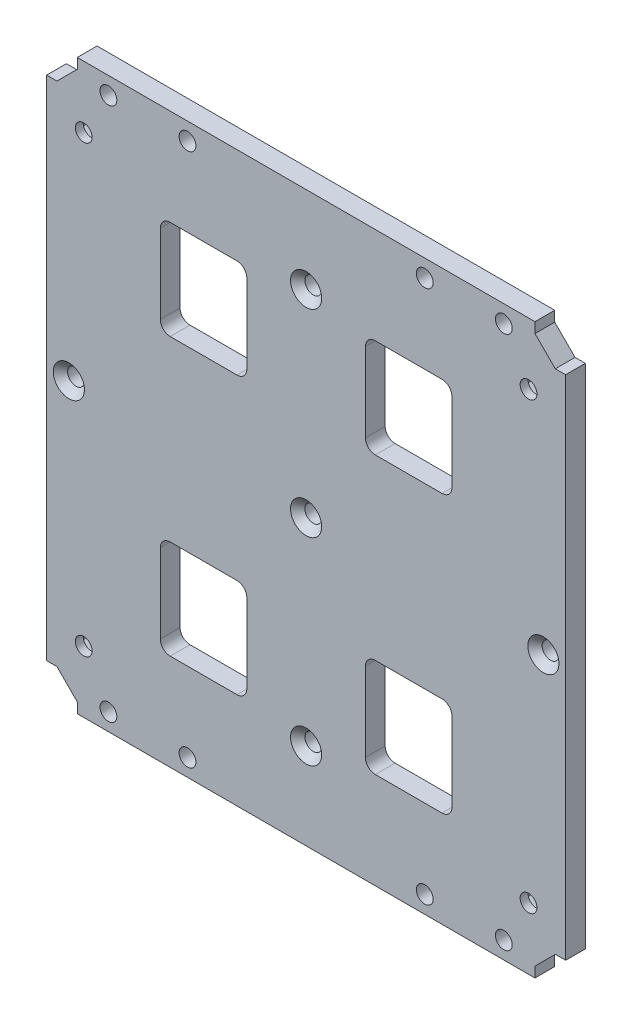
from build123d import *

# Parameters (mm, degrees)
BOSS_EXTRUDE1_DEPTH                             = 4
CUT_EXTRUDE4_DEPTH                              = 2.4
M3_CLEARANCE_HOLE1_D                            = 3.4
CSK_FOR_M3_FLAT_HEAD_MACHINE_SCREW1_D           = 3.4
CSK_FOR_M3_FLAT_HEAD_MACHINE_SCREW1_CSINK_D     = 6.3
CSK_FOR_M3_FLAT_HEAD_MACHINE_SCREW1_CSINK_ANGLE = 90
SKETCH11_W                                      = 17.5
SKETCH11_H                                      = 20
CUT_EXTRUDE3_DEPTH                              = 78.964735618
FILLET1_R                                       = 2
CSK_FOR_M3_FLAT_HEAD_MACHINE_SCREW2_D           = 3.4
CSK_FOR_M3_FLAT_HEAD_MACHINE_SCREW2_CSINK_D     = 6.3
CSK_FOR_M3_FLAT_HEAD_MACHINE_SCREW2_CSINK_ANGLE = 90
MOVE_FACE1_DEPTH                                = 4


# Read off the part's stored shape, not the designer's step: Move Face1
with BuildPart() as part:
    # Sketch2 → Boss-Extrude1 (new body)
    with BuildSketch(Plane.XY):
        Polygon((0, 57.5), (0, 0), (52.5, 0), (52.5, 51.5), (50.5, 51.5), (46.5, 55.5), (46.5, 57.5), align=None)
    extrude(amount=BOSS_EXTRUDE1_DEPTH)

    # Sketch12 → Cut-Extrude4 (cut)
    with BuildSketch(Plane.XY):
        Polygon((45, 41.766838493), (47.8, 43.383419246), (47.8, 46.616580754), (45, 48.233161507), (42.2, 46.616580754), (42.2, 43.383419246), align=None)
    extrude(amount=CUT_EXTRUDE4_DEPTH, mode=Mode.SUBTRACT)

    # M3 Clearance Hole1 (through all)
    with Locations(Plane.XY.offset(4)):
        with Locations((45, 45), (-45, 45), (-45, -45), (45, -45)):
            Hole(M3_CLEARANCE_HOLE1_D / 2)

    # CSK for M3 Flat Head Machine Screw1 (through all)
    with Locations(Plane.XY.offset(4)):
        with Locations((0, 40), (0, 0), (48, 0)):
            CounterSinkHole(CSK_FOR_M3_FLAT_HEAD_MACHINE_SCREW1_D / 2, CSK_FOR_M3_FLAT_HEAD_MACHINE_SCREW1_CSINK_D / 2, counter_sink_angle=CSK_FOR_M3_FLAT_HEAD_MACHINE_SCREW1_CSINK_ANGLE)

    # Sketch11 → Cut-Extrude3 (cut, through all)
    with BuildSketch(Plane.XY):
        with Locations((20.75, 28)):
            Rectangle(SKETCH11_W, SKETCH11_H)
    extrude(amount=CUT_EXTRUDE3_DEPTH, mode=Mode.SUBTRACT)

    # Fillet1
    fillet1_edges = [part.edges().sort_by_distance(p)[0] for p in [
        (29.5, 38, 2),
        (12, 38, 2),
        (12, 18, 2),
        (29.5, 18, 2),
    ]]
    fillet(fillet1_edges, radius=FILLET1_R)

    # CSK for M3 Flat Head Machine Screw2 (through all)
    with Locations(Plane(origin=(0, 0, 0), x_dir=(-1, 0, 0), z_dir=(0, 0, -1))):
        with Locations((-24, 54), (-40, 54)):
            CounterSinkHole(CSK_FOR_M3_FLAT_HEAD_MACHINE_SCREW2_D / 2, CSK_FOR_M3_FLAT_HEAD_MACHINE_SCREW2_CSINK_D / 2, counter_sink_angle=CSK_FOR_M3_FLAT_HEAD_MACHINE_SCREW2_CSINK_ANGLE)

    # Move Face1 outline → Move Face1 (cut)
    with BuildSketch(Plane.XY):
        Polygon((46.3, 55.417157288), (50.417157288, 51.3), (52.5, 51.3), (52.5, 51.5), (50.5, 51.5), (46.5, 55.5), (46.5, 57.5), (46.3, 57.5), align=None)
    extrude(amount=MOVE_FACE1_DEPTH, mode=Mode.SUBTRACT)

    # Mirror1: part across plane


with BuildPart() as part_1:
    add(part.part)
    add(part.part.mirror(Plane(origin=(0, 0, 0), x_dir=(0, 0, 1), z_dir=(0, -1, 0))))

    # Mirror2: part across plane


with BuildPart() as part_2:
    add(part_1.part)
    add(part_1.part.mirror(Plane(origin=(0, 0, 0), x_dir=(0, 0, 1), z_dir=(1, 0, 0))))


solid = part_2.part
